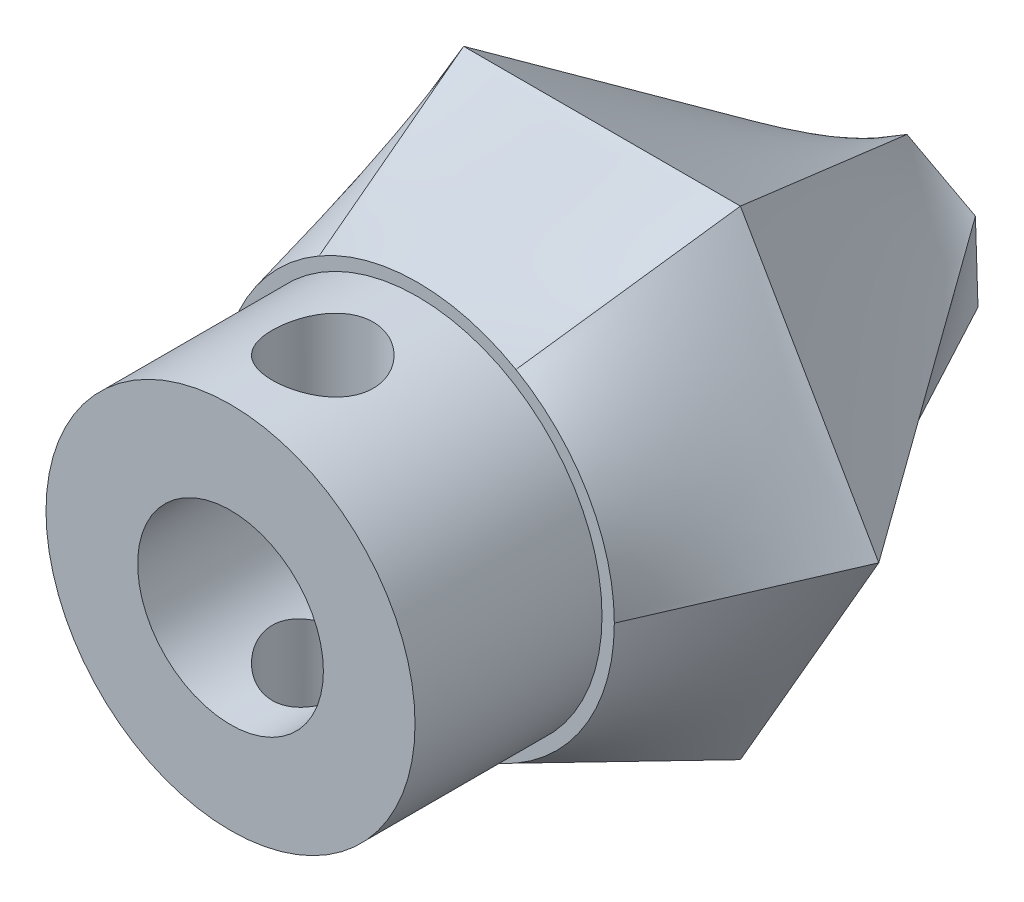
from build123d import *

# Parameters (mm, degrees)
SKETCH_1_R               = 15
SKETCH_1_R_2             = 7.55
EXTRUDE_1_DEPTH          = 15.2
CUT_EXTRUDE_1_DEPTH      = 27.096743092
CUT_EXTRUDE_1_DEPTH_BACK = 27.096743092
SKETCH_2_R               = 4.1
SKETCH_8_R               = 4
CUT_EXTRUDE_2_DEPTH      = 6


with BuildPart() as part:
    # 스케치1 → 보스-돌출1 (new body)
    with BuildSketch(Plane.XY):
        with Locations(Location((0, 0, 0), (0, 0, 180))):
            Circle(SKETCH_1_R)
        with Locations(Location((0, 0, 0), (0, 0, 180))):
            Circle(SKETCH_1_R_2, mode=Mode.SUBTRACT)
    extrude(amount=EXTRUDE_1_DEPTH)

    # 스케치2 → 컷-돌출1 (cut, two sides: drawn at the far end of the back side and taken through both)
    with BuildSketch(Plane(origin=(0, 0, 0), x_dir=(1, 0, 0), z_dir=(0, 1, 0)).offset(-CUT_EXTRUDE_1_DEPTH_BACK)):
        with Locations(Location((0, -7.7, 0), (0, 0, 270))):
            Circle(SKETCH_2_R)
    extrude(amount=CUT_EXTRUDE_1_DEPTH + CUT_EXTRUDE_1_DEPTH_BACK, mode=Mode.SUBTRACT)

    # 스케치3 for 로프트4 → 로프트4 section 0
    with BuildSketch(Plane.XY):
        with BuildLine():
            # circular arc as an exact rational Bezier (weights 1, cos(half-angle), 1)
            Bezier((8, -13.856406461), (16.000000001, -9.237604308), (16, 0), weights=[1, 0.866025404, 1])
            Bezier((16, 0), (16.000000001, 9.237604308), (8, 13.856406461), weights=[1, 0.866025404, 1])
            Bezier((8, 13.856406461), (0, 18.475208613), (-8, 13.856406461), weights=[1, 0.866025404, 1])
            Bezier((-8, 13.856406461), (-16.000000001, 9.237604308), (-16, 0), weights=[1, 0.866025404, 1])
            Bezier((-16, 0), (-16.000000001, -9.237604308), (-8, -13.856406461), weights=[1, 0.866025404, 1])
            Bezier((-8, -13.856406461), (0, -18.475208613), (8, -13.856406461), weights=[1, 0.866025404, 1])
        make_face()
    # 스케치4 → 로프트4 section 1
    with BuildSketch(Plane.XY.offset(-15)):
        with BuildLine():
            Line((11.25, -19.485571585), (22.5, 0))
            Line((22.5, 0), (11.25, 19.485571585))
            Line((11.25, 19.485571585), (-11.25, 19.485571585))
            Line((-11.25, 19.485571585), (-22.5, 0))
            Line((-22.5, 0), (-11.25, -19.485571585))
            Line((-11.25, -19.485571585), (11.25, -19.485571585))
        make_face()
    loft()

    # 로프트5: read off the stored shape, not the designer's step
    # 로프트5: loft between two sections, ruled curve by curve
    loft_5_from = [
        Edge.make_bspline([(22.5, 0, -15), (20.625, -3.247595264, -15), (18.75, -6.495190528, -15), (15, -12.990381057, -15), (13.125, -16.237976321, -15), (11.25, -19.485571585, -15)], [0, 0, 0, 0, 0.5, 0.5, 1, 1, 1, 1], 3),
        Edge.make_bspline([(11.25, -19.485571585, -15), (7.5, -19.485571585, -15), (3.75, -19.485571585, -15), (-3.75, -19.485571585, -15), (-7.5, -19.485571585, -15), (-11.25, -19.485571585, -15)], [0, 0, 0, 0, 0.5, 0.5, 1, 1, 1, 1], 3),
        Edge.make_bspline([(11.25, 19.485571585, -15), (13.125, 16.237976321, -15), (15, 12.990381057, -15), (18.75, 6.495190528, -15), (20.625, 3.247595264, -15), (22.5, 0, -15)], [0, 0, 0, 0, 0.5, 0.5, 1, 1, 1, 1], 3),
        Edge.make_bspline([(-11.25, -19.485571585, -15), (-13.125, -16.237976321, -15), (-15, -12.990381057, -15), (-18.75, -6.495190528, -15), (-20.625, -3.247595264, -15), (-22.5, 0, -15)], [0, 0, 0, 0, 0.5, 0.5, 1, 1, 1, 1], 3),
        Edge.make_bspline([(-22.5, 0, -15), (-20.625, 3.247595264, -15), (-18.75, 6.495190528, -15), (-15, 12.990381057, -15), (-13.125, 16.237976321, -15), (-11.25, 19.485571585, -15)], [0, 0, 0, 0, 0.5, 0.5, 1, 1, 1, 1], 3),
        Edge.make_bspline([(-11.25, 19.485571585, -15), (-7.5, 19.485571585, -15), (-3.75, 19.485571585, -15), (3.75, 19.485571585, -15), (7.5, 19.485571585, -15), (11.25, 19.485571585, -15)], [0, 0, 0, 0, 0.5, 0.5, 1, 1, 1, 1], 3),
    ]
    loft_5_to = [
        Edge.make_bspline([(5.352991825, 3.333635602, -40), (5.388078026, 2.283194817, -40), (5.423164227, 1.232754033, -40), (5.493336629, -0.868127536, -40), (5.52842283, -1.918568321, -40), (5.563509031, -2.969009106, -40)], [0, 0, 0, 0, 0.5, 0.5, 1, 1, 1, 1], 3),
        Edge.make_bspline([(5.563509031, -2.969009106, -40), (4.671343726, -3.524615039, -40), (3.779178422, -4.080220973, -40), (1.994847814, -5.19143284, -40), (1.10268251, -5.747038774, -40), (0.210517206, -6.302644707, -40)], [0, 0, 0, 0, 0.5, 0.5, 1, 1, 1, 1], 3),
        Edge.make_bspline([(-0.210517206, 6.302644707, -40), (0.716734299, 5.807809856, -40), (1.643985804, 5.312975006, -40), (3.498488815, 4.323305304, -40), (4.42574032, 3.828470453, -40), (5.352991825, 3.333635602, -40)], [0, 0, 0, 0, 0.5, 0.5, 1, 1, 1, 1], 3),
        Edge.make_bspline([(0.210517206, -6.302644707, -40), (-0.716734299, -5.807809856, -40), (-1.643985804, -5.312975006, -40), (-3.498488815, -4.323305304, -40), (-4.42574032, -3.828470453, -40), (-5.352991825, -3.333635602, -40)], [0, 0, 0, 0, 0.5, 0.5, 1, 1, 1, 1], 3),
        Edge.make_bspline([(-5.352991825, -3.333635602, -40), (-5.388078026, -2.283194817, -40), (-5.423164227, -1.232754033, -40), (-5.493336629, 0.868127536, -40), (-5.52842283, 1.918568321, -40), (-5.563509031, 2.969009106, -40)], [0, 0, 0, 0, 0.5, 0.5, 1, 1, 1, 1], 3),
        Edge.make_bspline([(-5.563509031, 2.969009106, -40), (-4.671343726, 3.524615039, -40), (-3.779178422, 4.080220973, -40), (-1.994847814, 5.19143284, -40), (-1.10268251, 5.747038774, -40), (-0.210517206, 6.302644707, -40)], [0, 0, 0, 0, 0.5, 0.5, 1, 1, 1, 1], 3),
    ]
    loft_5 = Solid(Shell([*[Face.make_surface_from_curves(loft_5_from[k], loft_5_to[k]) for k in range(6)], Face(Wire(loft_5_from)), Face(Wire(loft_5_to))]))
    add(loft_5)

    # 스케치8 → 컷-돌출2 (cut)
    with BuildSketch(Plane(origin=(0, 0, -40), x_dir=(-1, 0, 0), z_dir=(0, 0, -1))):
        Circle(SKETCH_8_R)
    extrude(amount=-CUT_EXTRUDE_2_DEPTH, mode=Mode.SUBTRACT)


solid = part.part
